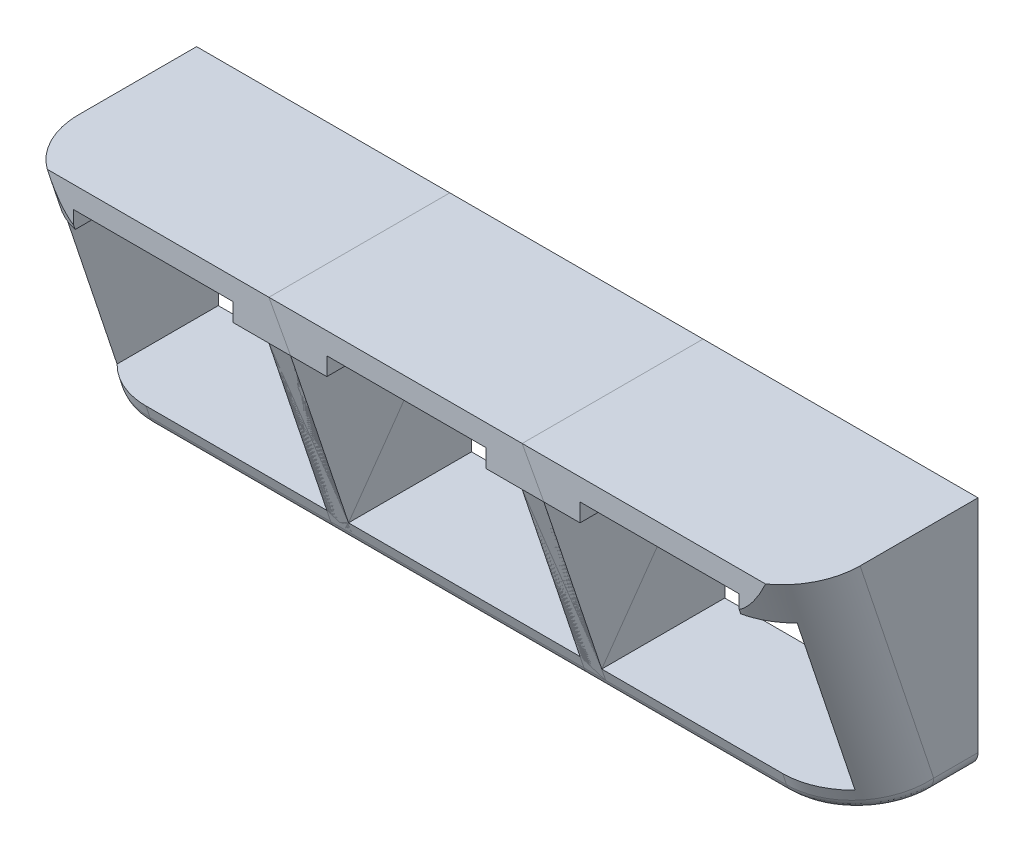
from build123d import *

# Parameters (mm, degrees)
SKETCH1_W           = 38
SKETCH1_H           = 32.5
BOSS_EXTRUDE1_DEPTH = 25
BOSS_EXTRUDE2_DEPTH = 2.5
CUT_EXTRUDE1_REACH  = 57.904
BOSS_EXTRUDE3_START = 1.5
BOSS_EXTRUDE3_DEPTH = 3
LPATTERN1_COUNT     = 3
LPATTERN1_PITCH     = 35
FILLET1_R           = 10
FILLET2_R           = 10
FILLET3_R           = 2
FILLET4_R           = 2
FILLET5_R           = 2


with BuildPart() as part:
    # Sketch1 → Boss-Extrude1 (new body)
    with BuildSketch(Plane.XY):
        with Locations((19, 16.25)):
            Rectangle(SKETCH1_W, SKETCH1_H)
        Polygon((8, 27), (8, 29.5), (30, 29.5), (30, 27), (35, 27), (35, 3), (3, 3), (3, 27), align=None, mode=Mode.SUBTRACT)
    extrude(amount=BOSS_EXTRUDE1_DEPTH)

    # Sketch3 → Boss-Extrude2 (add)
    with BuildSketch(Plane.XZ.offset(-29.5)):
        Polygon((8, 0), (30, 0), (30, 11), (22, 11), (22, 9.5), (16, 9.5), (16, 11), (8, 11), align=None)
    extrude(amount=BOSS_EXTRUDE2_DEPTH)

    # Cut-Extrude1: up to this face of the body (flat: up to its plane)
    cut_extrude1_end = Plane(part.part.faces().sort_by_distance((38, 16.25, 12.5))[0])
    # Sketch4 → Cut-Extrude1 (cut, up to the picked face)
    with BuildSketch(Plane.ZY, mode=Mode.PRIVATE) as cut_extrude1_sk1:
        Polygon((25, 27), (16, 0), (25, 0), align=None)
    cut_extrude1_tool1 = split(extrude(cut_extrude1_sk1.sketch, amount=-CUT_EXTRUDE1_REACH, mode=Mode.PRIVATE), bisect_by=cut_extrude1_end, keep=Keep.BOTH, mode=Mode.PRIVATE)
    add(cut_extrude1_tool1.solids().sort_by(Axis((0, 9, 22), (1, 0, 0)))[0], mode=Mode.SUBTRACT)

    # Sketch6 → Boss-Extrude3 (add)
    with BuildSketch(Plane.ZY.offset(-22).offset(BOSS_EXTRUDE3_START)):
        Polygon((9.5, 29.5), (11.14, 27.86), (15.5, 29.5), align=None)
    extrude(amount=BOSS_EXTRUDE3_DEPTH)


with BuildPart() as lpattern1_1:
    # LPattern1: pattern copy
    add(part.part.moved(Location(Vector(1, 0, 0) * (1 * LPATTERN1_PITCH))))

    # Fillet4
    fillet4_edges = [lpattern1_1.edges().sort_by_distance(p)[0] for p in [
        (54, 0, 16),
    ]]
    fillet(fillet4_edges, radius=FILLET4_R)


with BuildPart() as lpattern1_2:
    # LPattern1: pattern copy
    add(part.part.moved(Location(Vector(1, 0, 0) * (2 * LPATTERN1_PITCH))))

    # Fillet1
    # the kernel refuses this fillet: 10 mm, written as the material it takes off along each edge
    with BuildSketch(Plane(origin=(108, 50.717082451, 32.90569415), x_dir=(0, 0.316227766016838, -0.9486832980505138), z_dir=(0, -0.9486832980505139, -0.316227766016838))) as fillet1_piece_1:
        with BuildLine():
            CenterArc((FILLET1_R, -FILLET1_R), FILLET1_R, 90, 90)
            Line((0, -FILLET1_R), (0, 0))
            Line((0, 0), (FILLET1_R, 0))
        make_face()
    extrude(amount=78.460498942, mode=Mode.SUBTRACT)

    # Fillet5
    fillet5_edges = [lpattern1_2.edges().sort_by_distance(p)[0] for p in [
        (84, 0, 16),
        (108, 0, 2.729537233),
        (105.163482835, 0, 12.813930283),
    ]]
    fillet(fillet5_edges, radius=FILLET5_R)


with BuildPart() as part_1:
    add(part.part)

    # Fillet2
    # the kernel refuses this fillet: 10 mm, written as the material it takes off along each edge
    with BuildSketch(Plane(origin=(0, 50.717082451, 32.90569415), x_dir=(1, 0, 0), z_dir=(0, -0.9486832980505139, -0.316227766016838))) as fillet2_piece_1:
        with BuildLine():
            CenterArc((FILLET2_R, -FILLET2_R), FILLET2_R, 90, 90)
            Line((0, -FILLET2_R), (0, 0))
            Line((0, 0), (FILLET2_R, 0))
        make_face()
    extrude(amount=78.460498942, mode=Mode.SUBTRACT)

    # Fillet3
    fillet3_edges = [part_1.edges().sort_by_distance(p)[0] for p in [
        (0, 0, 2.729537233),
        (2.836517165, 0, 12.813930283),
        (24, 0, 16),
    ]]
    fillet(fillet3_edges, radius=FILLET3_R)


solid = Compound([lpattern1_1.part, lpattern1_2.part, part_1.part])
